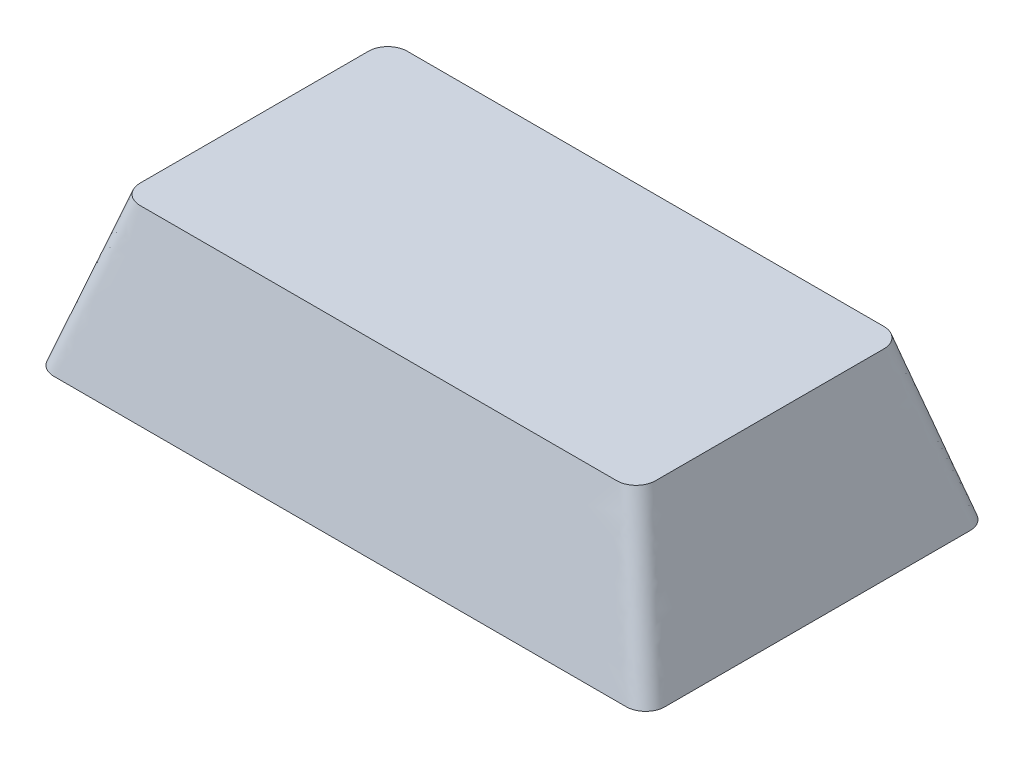
from build123d import *


with BuildPart() as part:
    # Croquis3 for Recubrir1 → Recubrir1 section 0
    with BuildSketch(Plane(origin=(0, 8.001, 0), x_dir=(1, 0, 0), z_dir=(0, 1, 0))):
        with BuildLine():
            Line((-12.4841, -6.9977), (12.4841, -6.9977))
            # circular arc as an exact rational Bezier (weights 1, cos(half-angle), 1)
            Bezier((12.4841, -6.9977), (13.5001, -6.9977), (13.5001, -5.9817), weights=[1, 0.707106781, 1])
            Line((13.5001, -5.9817), (13.5001, 5.9817))
            Bezier((13.5001, 5.9817), (13.5001, 6.9977), (12.4841, 6.9977), weights=[1, 0.707106781, 1])
            Line((12.4841, 6.9977), (-12.4841, 6.9977))
            Bezier((-12.4841, 6.9977), (-13.5001, 6.9977), (-13.5001, 5.9817), weights=[1, 0.707106781, 1])
            Line((-13.5001, 5.9817), (-13.5001, -5.9817))
            Bezier((-13.5001, -5.9817), (-13.5001, -6.9977), (-12.4841, -6.9977), weights=[1, 0.707106781, 1])
        make_face()
    # Croquis2 for Recubrir1 → Recubrir1 section 1
    with BuildSketch(Plane(origin=(0, 0, 0), x_dir=(1, 0, 0), z_dir=(0, 1, 0))):
        with BuildLine():
            Line((-14.986, -9.0043), (14.986, -9.0043))
            Bezier((14.986, -9.0043), (16.002, -9.0043), (16.002, -7.9883), weights=[1, 0.707106781, 1])
            Line((16.002, -7.9883), (16.002, 7.9883))
            Bezier((16.002, 7.9883), (16.002, 9.0043), (14.986, 9.0043), weights=[1, 0.707106781, 1])
            Line((14.986, 9.0043), (-14.986, 9.0043))
            Bezier((-14.986, 9.0043), (-16.002, 9.0043), (-16.002, 7.9883), weights=[1, 0.707106781, 1])
            Line((-16.002, 7.9883), (-16.002, -7.9883))
            Bezier((-16.002, -7.9883), (-16.002, -9.0043), (-14.986, -9.0043), weights=[1, 0.707106781, 1])
        make_face()
    loft()


solid = part.part
